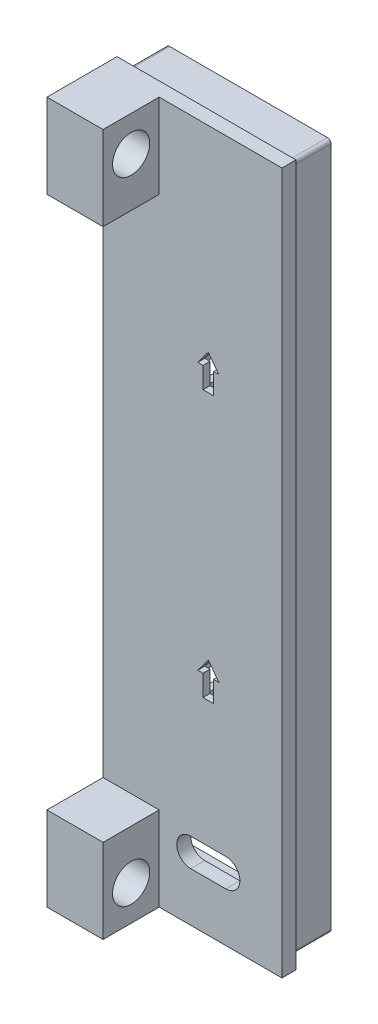
from build123d import *

# Parameters (mm, degrees)
SKETCH1_W               = 80
SKETCH1_H               = 100
SKETCH1_W_2             = 31
SKETCH1_H_2             = 11
SKETCH1_W_3             = 11
SKETCH1_H_3             = 31
BOSS_EXTRUDE1_DEPTH     = 1
SKETCH2_W               = 80
SKETCH2_H               = 100
BACK_DEPTH              = 1
SKETCH3_W               = 13
SKETCH3_H               = 33
SKETCH3_W_2             = 11
SKETCH3_H_2             = 31
SKETCH3_W_3             = 33
SKETCH3_H_3             = 13
SKETCH3_W_4             = 31
SKETCH3_H_4             = 11
SEG_MASKS_DEPTH         = 6
SKETCH5_W               = 78
SKETCH5_H               = 98
SKETCH5_W_2             = 76
SKETCH5_H_2             = 96
OUTER_RIM_DEPTH         = 6
DIRECTION_DEPTH         = 65.412731661
DIRECTION_DEPTH_BACK    = 65.412731661
SKETCH7_W               = 17
SKETCH7_H               = 7
SKETCH7_W_2             = 7
SKETCH7_H_2             = 11.013011135
SKETCH7_H_3             = 10.96937703
SKETCH7_H_4             = 11.03062297
WIRE_CHASES_DEPTH       = 6
HANGING_HOLE_DEPTH      = 65.311740763
HANGING_HOLE_DEPTH_BACK = 65.311740763
FILLET1_R               = 0.5
SKETCH9_W               = 8
SKETCH9_H               = 12
BOSS_EXTRUDE2_DEPTH     = 8
CUT_EXTRUDE1_DEPTH      = 95.868329805
CUT_EXTRUDE1_DEPTH_BACK = 95.868329805
SKETCH10_R              = 1.7
SKETCH11_R              = 2.65
CUT_EXTRUDE2_DEPTH      = 3.9
MIRROR4_COPY_1_SKETCH_R = 2.65
MIRROR4_COPY_1_DEPTH    = 3.9
MIRROR4_COPY_2_SKETCH_R = 2.65
MIRROR4_COPY_2_DEPTH    = 3.9
SKETCH12_W              = 1.5
SKETCH12_H              = 7
BOSS_EXTRUDE3_DEPTH     = 6
SKETCH13_W              = 15.5
SKETCH13_H              = 1.5
BOSS_EXTRUDE4_DEPTH     = 1.5
FILLET2_R               = 1.5
CUT_EXTRUDE3_DEPTH      = 65.807406984
CUT_EXTRUDE3_DEPTH_BACK = 65.807406984
CUT_EXTRUDE4_DEPTH      = 65.807406984
CUT_EXTRUDE4_DEPTH_BACK = 65.807406984
SKETCH15_W              = 64.445806935
SKETCH15_H              = 114.080539226
SKETCH16_W              = 2
SKETCH16_H              = 100
BOSS_EXTRUDE5_DEPTH     = 8
CUT_EXTRUDE5_DEPTH      = 65.807406984
CUT_EXTRUDE5_DEPTH_BACK = 65.807406984
CUT_EXTRUDE6_DEPTH      = 6
FILLET3_R               = 0.5


with BuildPart() as part:
    # Sketch1 → Boss-Extrude1 (new body)
    with BuildSketch(Plane.XY):
        Rectangle(SKETCH1_W, SKETCH1_H)
        with Locations((0, 38)):
            Rectangle(SKETCH1_W_2, SKETCH1_H_2, mode=Mode.SUBTRACT)
        Rectangle(SKETCH1_W_2, SKETCH1_H_2, mode=Mode.SUBTRACT)
        with Locations((0, -38)):
            Rectangle(SKETCH1_W_2, SKETCH1_H_2, mode=Mode.SUBTRACT)
        with Locations((25, 19)):
            Rectangle(SKETCH1_W_3, SKETCH1_H_3, mode=Mode.SUBTRACT)
        with Locations((-25, 19)):
            Rectangle(SKETCH1_W_3, SKETCH1_H_3, mode=Mode.SUBTRACT)
        with Locations((-25, -19)):
            Rectangle(SKETCH1_W_3, SKETCH1_H_3, mode=Mode.SUBTRACT)
        with Locations((25, -19)):
            Rectangle(SKETCH1_W_3, SKETCH1_H_3, mode=Mode.SUBTRACT)
    extrude(amount=BOSS_EXTRUDE1_DEPTH)

    # Sketch2 → back (add)
    with BuildSketch(Plane.XY.offset(1)):
        Rectangle(SKETCH2_W, SKETCH2_H)
    extrude(amount=BACK_DEPTH)

    # Sketch3 → seg masks (add)
    # profile 1 of 7: a face of its own
    with BuildSketch(Plane(origin=(0, 0, 0), x_dir=(-1, 0, 0), z_dir=(0, 0, -1))):
        with Locations((-25, 19)):
            Rectangle(SKETCH3_W, SKETCH3_H)
        with Locations((-25, 19)):
            Rectangle(SKETCH3_W_2, SKETCH3_H_2, mode=Mode.SUBTRACT)
    # profile 2 of 7: a face of its own
    with BuildSketch(Plane(origin=(0, 0, 0), x_dir=(-1, 0, 0), z_dir=(0, 0, -1))):
        with Locations((0, 38)):
            Rectangle(SKETCH3_W_3, SKETCH3_H_3)
        with Locations((0, 38)):
            Rectangle(SKETCH3_W_4, SKETCH3_H_4, mode=Mode.SUBTRACT)
    # profile 3 of 7: a face of its own
    with BuildSketch(Plane(origin=(0, 0, 0), x_dir=(-1, 0, 0), z_dir=(0, 0, -1))):
        with Locations((25, 19)):
            Rectangle(SKETCH3_W, SKETCH3_H)
        with Locations((25, 19)):
            Rectangle(SKETCH3_W_2, SKETCH3_H_2, mode=Mode.SUBTRACT)
    # profile 4 of 7: a face of its own
    with BuildSketch(Plane(origin=(0, 0, 0), x_dir=(-1, 0, 0), z_dir=(0, 0, -1))):
        Rectangle(SKETCH3_W_3, SKETCH3_H_3)
        Rectangle(SKETCH3_W_4, SKETCH3_H_4, mode=Mode.SUBTRACT)
    # profile 5 of 7: a face of its own
    with BuildSketch(Plane(origin=(0, 0, 0), x_dir=(-1, 0, 0), z_dir=(0, 0, -1))):
        with Locations((-25, -19)):
            Rectangle(SKETCH3_W, SKETCH3_H)
        with Locations((-25, -19)):
            Rectangle(SKETCH3_W_2, SKETCH3_H_2, mode=Mode.SUBTRACT)
    # profile 6 of 7: a face of its own
    with BuildSketch(Plane(origin=(0, 0, 0), x_dir=(-1, 0, 0), z_dir=(0, 0, -1))):
        with Locations((0, -38)):
            Rectangle(SKETCH3_W_3, SKETCH3_H_3)
        with Locations((0, -38)):
            Rectangle(SKETCH3_W_4, SKETCH3_H_4, mode=Mode.SUBTRACT)
    # profile 7 of 7: a face of its own
    with BuildSketch(Plane(origin=(0, 0, 0), x_dir=(-1, 0, 0), z_dir=(0, 0, -1))):
        with Locations((25, -19)):
            Rectangle(SKETCH3_W, SKETCH3_H)
        with Locations((25, -19)):
            Rectangle(SKETCH3_W_2, SKETCH3_H_2, mode=Mode.SUBTRACT)
    extrude(amount=SEG_MASKS_DEPTH)

    # Sketch5 → outer rim (add)
    with BuildSketch(Plane(origin=(0, 0, 0), x_dir=(-1, 0, 0), z_dir=(0, 0, -1))):
        Rectangle(SKETCH5_W, SKETCH5_H)
        Rectangle(SKETCH5_W_2, SKETCH5_H_2, mode=Mode.SUBTRACT)
    extrude(amount=OUTER_RIM_DEPTH)

    # Sketch6 → direction (cut, two sides: drawn at the far end of the back side and taken through both)
    with BuildSketch(Plane(origin=(0, 0, 1), x_dir=(-1, 0, 0), z_dir=(0, 0, -1)).offset(-DIRECTION_DEPTH_BACK)):
        Polygon((25, 22), (23.5, 20), (24.25, 20), (24.25, 17), (25.75, 17), (25.75, 20), (26.5, 20), align=None)
        Polygon((-3, 38), (-1, 36.5), (-1, 37.25), (2, 37.25), (2, 38.75), (-1, 38.75), (-1, 39.5), align=None)
        Polygon((-24.25, 21), (-25.75, 21), (-25.75, 18.5), (-26.5, 18.5), (-25, 16), (-23.5, 18.5), (-24.25, 18.5), align=None)
        Polygon((-24.25, -17), (-25.75, -17), (-25.75, -20), (-26.5, -20), (-25, -22), (-23.5, -20), (-24.25, -20), align=None)
        Polygon((-2, -38.75), (-2, -37.25), (1, -37.25), (1, -36.5), (3, -38), (1, -39.5), (1, -38.75), align=None)
        Polygon((25, -16), (23.5, -18), (24.25, -18), (24.25, -21), (25.75, -21), (25.75, -18), (26.5, -18), align=None)
        Polygon((-0.5, 1.5), (-3, 0), (-0.5, -1.5), (-0.5, -0.75), (2, -0.75), (2, 0), (2, 0.75), (-0.5, 0.75), align=None)
    extrude(amount=DIRECTION_DEPTH + DIRECTION_DEPTH_BACK, mode=Mode.SUBTRACT)

    # Sketch7 → wire chases (cut)
    with BuildSketch(Plane(origin=(0, 0, -6), x_dir=(-1, 0, 0), z_dir=(0, 0, -1))):
        Polygon((-6.5, 46), (-3.5, 46), (-3.5, 39.513011135), (3.5, 39.513011135), (3.5, 46), (6.5, 46), (6.5, 39.513011135), (18, 39.513011135), (18, 36.513011135), (6.5, 36.513011135), (6.5, 25.5), (23.5, 25.5), (23.5, 37.5), (26.5, 37.5), (26.5, 25.5), (33, 25.5), (33, 22.5), (26.5, 22.5), (26.5, 15.5), (33, 15.5), (33, 12.5), (26.5, 12.5), (26.5, -12.5), (33, -12.5), (33, -15.5), (26.5, -15.5), (26.5, -22.5), (33, -22.5), (33, -25.5), (26.5, -25.5), (26.5, -37.5), (23.5, -37.5), (23.5, -25.5), (6.5, -25.5), (6.5, -36.513011135), (18, -36.513011135), (18, -39.513011135), (6.5, -39.513011135), (6.5, -46), (3.5, -46), (3.5, -39.513011135), (-3.5, -39.513011135), (-3.5, -46), (-6.5, -46), (-6.5, -39.513011135), (-18, -39.513011135), (-18, -36.513011135), (-6.5, -36.513011135), (-6.5, -25.5), (-23.5, -25.5), (-23.5, -37.5), (-26.5, -37.5), (-26.5, -25.5), (-33, -25.5), (-33, -22.5), (-26.5, -22.5), (-26.5, -15.5), (-33, -15.5), (-33, -12.5), (-26.5, -12.5), (-26.5, 12.5), (-33, 12.5), (-33, 15.5), (-26.5, 15.5), (-26.5, 22.5), (-33, 22.5), (-33, 25.5), (-26.5, 25.5), (-26.5, 37.5), (-23.5, 37.5), (-23.5, 25.5), (-6.5, 25.5), (-6.5, 36.513011135), (-18, 36.513011135), (-18, 39.513011135), (-6.5, 39.513011135), align=None)
        with Locations((-15, 19)):
            Rectangle(SKETCH7_W, SKETCH7_H, mode=Mode.SUBTRACT)
        with Locations((0, 31.006505567)):
            Rectangle(SKETCH7_W_2, SKETCH7_H_2, mode=Mode.SUBTRACT)
        with Locations((0, 19)):
            Rectangle(SKETCH7_W_2, SKETCH7_H, mode=Mode.SUBTRACT)
        with Locations((15, 19)):
            Rectangle(SKETCH7_W, SKETCH7_H, mode=Mode.SUBTRACT)
        Polygon((-6.5, 12.5), (-6.5, 1.53062297), (-18, 1.53062297), (-18, -1.46937703), (-6.5, -1.46937703), (-6.5, -12.5), (-23.5, -12.5), (-23.5, 12.5), align=None, mode=Mode.SUBTRACT)
        with Locations((0, 7.015311485)):
            Rectangle(SKETCH7_W_2, SKETCH7_H_3, mode=Mode.SUBTRACT)
        Polygon((6.5, 12.5), (23.5, 12.5), (23.5, -12.5), (6.5, -12.5), (6.5, -1.46937703), (18, -1.46937703), (18, 1.53062297), (6.5, 1.53062297), align=None, mode=Mode.SUBTRACT)
        with Locations((-15, -19)):
            Rectangle(SKETCH7_W, SKETCH7_H, mode=Mode.SUBTRACT)
        with Locations((0, -6.984688515)):
            Rectangle(SKETCH7_W_2, SKETCH7_H_4, mode=Mode.SUBTRACT)
        with Locations((0, -19)):
            Rectangle(SKETCH7_W_2, SKETCH7_H, mode=Mode.SUBTRACT)
        with Locations((15, -19)):
            Rectangle(SKETCH7_W, SKETCH7_H, mode=Mode.SUBTRACT)
        with Locations((0, -31.006505567)):
            Rectangle(SKETCH7_W_2, SKETCH7_H_2, mode=Mode.SUBTRACT)
    extrude(amount=-WIRE_CHASES_DEPTH, mode=Mode.SUBTRACT)

    # Sketch8 → hanging hole (cut, two sides: drawn at the far end of the back side and taken through both)
    with BuildSketch(Plane(origin=(0, 0, 0), x_dir=(-1, 0, 0), z_dir=(0, 0, -1)).offset(-HANGING_HOLE_DEPTH_BACK)):
        with BuildLine():
            Line((2, 27), (2, 22.464101615))
            ThreePointArc((2, 22.464101615), (0, 15), (-2, 22.464101615))
            Line((-2, 22.464101615), (-2, 27))
            ThreePointArc((-2, 27), (0, 29), (2, 27))
        make_face()
    extrude(amount=HANGING_HOLE_DEPTH + HANGING_HOLE_DEPTH_BACK, mode=Mode.SUBTRACT)

    # Fillet1
    fillet1_edges = [part.edges().sort_by_distance(p)[0] for p in [
        (-39, -49, -3),
        (-39, 49, -3),
        (39, 49, -3),
        (39, -49, -3),
        (38, -48, -3),
        (-38, -48, -3),
        (-38, 48, -3),
        (38, 48, -3),
    ]]
    fillet(fillet1_edges, radius=FILLET1_R)

    # Sketch9 → Boss-Extrude2 (add)
    with BuildSketch(Plane.XY.offset(2)):
        with Locations((-36, 44)):
            Rectangle(SKETCH9_W, SKETCH9_H)
        with Locations((-36, -44)):
            Rectangle(SKETCH9_W, SKETCH9_H)
        with Locations((36, -44)):
            Rectangle(SKETCH9_W, SKETCH9_H)
        with Locations((36, 44)):
            Rectangle(SKETCH9_W, SKETCH9_H)
    extrude(amount=BOSS_EXTRUDE2_DEPTH)

    # Sketch10 → Cut-Extrude1 (cut, two sides: drawn at the far end of the back side and taken through both)
    with BuildSketch(Plane(origin=(40, 0, 0), x_dir=(0, 0, -1), z_dir=(1, 0, 0)).offset(-CUT_EXTRUDE1_DEPTH_BACK)):
        with Locations((-6, 45)):
            Circle(SKETCH10_R)
        with Locations((-6, -45)):
            Circle(SKETCH10_R)
    extrude(amount=CUT_EXTRUDE1_DEPTH + CUT_EXTRUDE1_DEPTH_BACK, mode=Mode.SUBTRACT)

    # Sketch11 → Cut-Extrude2 (cut)
    with BuildSketch(Plane(origin=(-32, 0, 0), x_dir=(0, 0, -1), z_dir=(1, 0, 0))):
        with Locations((-6, 45)):
            Circle(SKETCH11_R)
    cut_extrude2 = extrude(amount=-CUT_EXTRUDE2_DEPTH, mode=Mode.SUBTRACT)

    # Mirror1: Cut-Extrude2 across plane
    add(cut_extrude2.mirror(Plane.ZX), mode=Mode.SUBTRACT)

    # Mirror2: Cut-Extrude2 across plane
    add(cut_extrude2.mirror(Plane(origin=(0, 0, 0), x_dir=(0, 0, 1), z_dir=(1, 0, 0))), mode=Mode.SUBTRACT)

    # Mirror4 copy 1 sketch → Mirror4 copy 1 (cut)
    with BuildSketch(Plane(origin=(32, 0, 0), x_dir=(0, 0, -1), z_dir=(-1, 0, 0))):
        with Locations((-6, 45)):
            Circle(MIRROR4_COPY_1_SKETCH_R)
    extrude(amount=-MIRROR4_COPY_1_DEPTH, mode=Mode.SUBTRACT)

    # Mirror4 copy 2 sketch → Mirror4 copy 2 (cut)
    with BuildSketch(Plane(origin=(32, 0, 0), x_dir=(0, 0, -1), z_dir=(-1, 0, 0))):
        with Locations((-6, -45)):
            Circle(MIRROR4_COPY_2_SKETCH_R)
    extrude(amount=-MIRROR4_COPY_2_DEPTH, mode=Mode.SUBTRACT)

    # Sketch12 → Boss-Extrude3 (add)
    with BuildSketch(Plane.XY.offset(2)):
        with Locations((7.25, -18.5)):
            Rectangle(SKETCH12_W, SKETCH12_H)
        with Locations((21.25, -18.5)):
            Rectangle(SKETCH12_W, SKETCH12_H)
    extrude(amount=BOSS_EXTRUDE3_DEPTH)

    # Sketch13 → Boss-Extrude4 (add)
    with BuildSketch(Plane.XY.offset(2)):
        with Locations((14.25, -14.25)):
            Rectangle(SKETCH13_W, SKETCH13_H)
    extrude(amount=BOSS_EXTRUDE4_DEPTH)

    # Fillet2
    fillet2_edges = [part.edges().sort_by_distance(p)[0] for p in [
        (22, -17.75, 2),
        (14.25, -13.5, 2),
        (6.5, -17.75, 2),
    ]]
    fillet(fillet2_edges, radius=FILLET2_R - 0.0001)  # a hair under: the kernel refuses the full size

    # Sketch14 → Cut-Extrude3 (cut, two sides: drawn at the far end of the back side and taken through both)
    with BuildSketch(Plane(origin=(0, 0, 0), x_dir=(-1, 0, 0), z_dir=(0, 0, -1)).offset(-CUT_EXTRUDE3_DEPTH_BACK)):
        with BuildLine():
            Line((-2.5, -18), (2.5, -18))
            ThreePointArc((2.5, -18), (4.5, -20), (2.5, -22))
            Line((2.5, -22), (-2.5, -22))
            ThreePointArc((-2.5, -22), (-4.5, -20), (-2.5, -18))
        make_face()
    extrude(amount=CUT_EXTRUDE3_DEPTH + CUT_EXTRUDE3_DEPTH_BACK, mode=Mode.SUBTRACT)

    # Sketch15 → Cut-Extrude4 (cut, two sides: drawn at the far end of the back side and taken through both)
    with BuildSketch(Plane(origin=(0, 0, 0), x_dir=(-1, 0, 0), z_dir=(0, 0, -1)).offset(-CUT_EXTRUDE4_DEPTH_BACK)):
        with Locations((-15.722903468, -0.440805793)):
            Rectangle(SKETCH15_W, SKETCH15_H)
    extrude(amount=CUT_EXTRUDE4_DEPTH + CUT_EXTRUDE4_DEPTH_BACK, mode=Mode.SUBTRACT)

    # Sketch16 → Boss-Extrude5 (add)
    with BuildSketch(Plane(origin=(0, 0, -6), x_dir=(-1, 0, 0), z_dir=(0, 0, -1))):
        with Locations((15.5, 0)):
            Rectangle(SKETCH16_W, SKETCH16_H)
    extrude(amount=-BOSS_EXTRUDE5_DEPTH)

    # Sketch17 → Cut-Extrude5 (cut, two sides: drawn at the far end of the back side and taken through both)
    with BuildSketch(Plane(origin=(0, 0, 0), x_dir=(-1, 0, 0), z_dir=(0, 0, -1)).offset(-CUT_EXTRUDE5_DEPTH_BACK)):
        with BuildLine():
            Line((22.5, -39), (27.5, -39))
            ThreePointArc((27.5, -39), (29.5, -41), (27.5, -43))
            Line((27.5, -43), (22.5, -43))
            ThreePointArc((22.5, -43), (20.5, -41), (22.5, -39))
        make_face()
    extrude(amount=CUT_EXTRUDE5_DEPTH + CUT_EXTRUDE5_DEPTH_BACK, mode=Mode.SUBTRACT)

    # Sketch18 → Cut-Extrude6 (cut)
    with BuildSketch(Plane(origin=(0, 0, -6), x_dir=(-1, 0, 0), z_dir=(0, 0, -1))):
        Polygon((14.5, 50), (15.5, 50), (16.5, 50), (16.5, 49), (15.5, 49), (15.5, -49), (16.5, -49), (16.5, -50), (15.5, -50), (14.5, -50), align=None)
    extrude(amount=-CUT_EXTRUDE6_DEPTH, mode=Mode.SUBTRACT)

    # Fillet3
    fillet3_edges = [part.edges().sort_by_distance(p)[0] for p in [
        (-15.5, 49, -3),
        (-15.5, -49, -3),
    ]]
    fillet(fillet3_edges, radius=FILLET3_R)


solid = part.part
